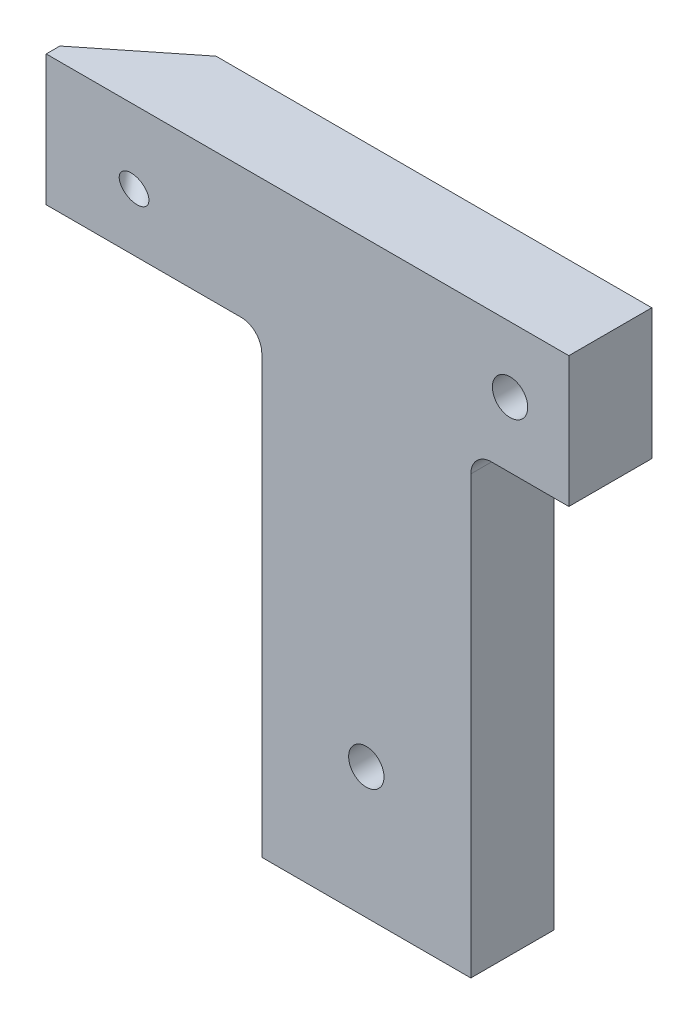
from build123d import *

# Parameters (mm, degrees)
SKETCH1_W                                      = 40
SKETCH1_H                                      = 45
BOSS_EXTRUDE1_DEPTH                            = 6.35
SKETCH4_W                                      = 20
SKETCH4_H                                      = 20
CUT_EXTRUDE1_DEPTH                             = 4
CUT_EXTRUDE2_DEPTH                             = 19
F_2_56_TAPPED_HOLE1_D                          = 1.778
CBORE_FOR_2_SOCKET_HEAD_CAP_SCREW1_D           = 2.7051
CBORE_FOR_2_SOCKET_HEAD_CAP_SCREW1_CBORE_D     = 4.7625
CBORE_FOR_2_SOCKET_HEAD_CAP_SCREW1_CBORE_DEPTH = 2.18439746


with BuildPart() as part:
    # Sketch1 → Boss-Extrude1 (new body)
    with BuildSketch(Plane.XY):
        with Locations((20, 22.5)):
            Rectangle(SKETCH1_W, SKETCH1_H)
    extrude(amount=BOSS_EXTRUDE1_DEPTH)

    # Sketch4 → Cut-Extrude1 (cut)
    with BuildSketch(Plane(origin=(-7.105440946, 3.099734639, -8.910242022), x_dir=(-0.7987821683376441, -0.19767427710044447, 0.5682182043182252), z_dir=(-0.6016203516718927, 0.26245569527040014, -0.7544335361543251))):
        with Locations((-8.89534247, 42.50158613)):
            Rectangle(SKETCH4_W, SKETCH4_H)
    extrude(amount=-CUT_EXTRUDE1_DEPTH, mode=Mode.SUBTRACT)

    # Sketch7 → Cut-Extrude2 (cut)
    with BuildSketch(Plane(origin=(0, 0, 0), x_dir=(-1, 0, 0), z_dir=(0, 0, -1))):
        with BuildLine():
            Line((0, 0), (-16.5, 0))
            Line((-16.5, 0), (-16.5, 33.4125))
            ThreePointArc((-16.5, 33.4125), (-16.035032015, 34.535032015), (-14.9125, 35))
            Line((-14.9125, 35), (0, 35))
            Line((0, 35), (0, 0))
        make_face()
        with BuildLine():
            Line((-40, 0), (-32.5, 0))
            Line((-32.5, 0), (-32.5, 33.4125))
            ThreePointArc((-32.5, 33.4125), (-32.964967985, 34.535032015), (-34.0875, 35))
            Line((-34.0875, 35), (-40, 35))
            Line((-40, 35), (-40, 0))
        make_face()
    extrude(amount=-CUT_EXTRUDE2_DEPTH, mode=Mode.SUBTRACT)

    # #2-56 Tapped Hole1 (through all)
    with Locations(Plane(origin=(-4.698959539, 2.049911858, -5.892507877), x_dir=(-0.7987821683376376, -0.19767427710045052, 0.5682182043182324), z_dir=(-0.6016203516719012, 0.26245569527040247, -0.7544335361543173))):
        with Locations((-9.55561749, 39.318324151)):
            Hole(F_2_56_TAPPED_HOLE1_D / 2)

    # CBORE for #2 Socket Head Cap Screw1 (through all)
    with Locations(Plane(origin=(0, 0, 0), x_dir=(-1, 0, 0), z_dir=(0, 0, -1))):
        with Locations((-24.5, 10), (-35.5, 40)):
            CounterBoreHole(CBORE_FOR_2_SOCKET_HEAD_CAP_SCREW1_D / 2, CBORE_FOR_2_SOCKET_HEAD_CAP_SCREW1_CBORE_D / 2, CBORE_FOR_2_SOCKET_HEAD_CAP_SCREW1_CBORE_DEPTH)


solid = part.part
